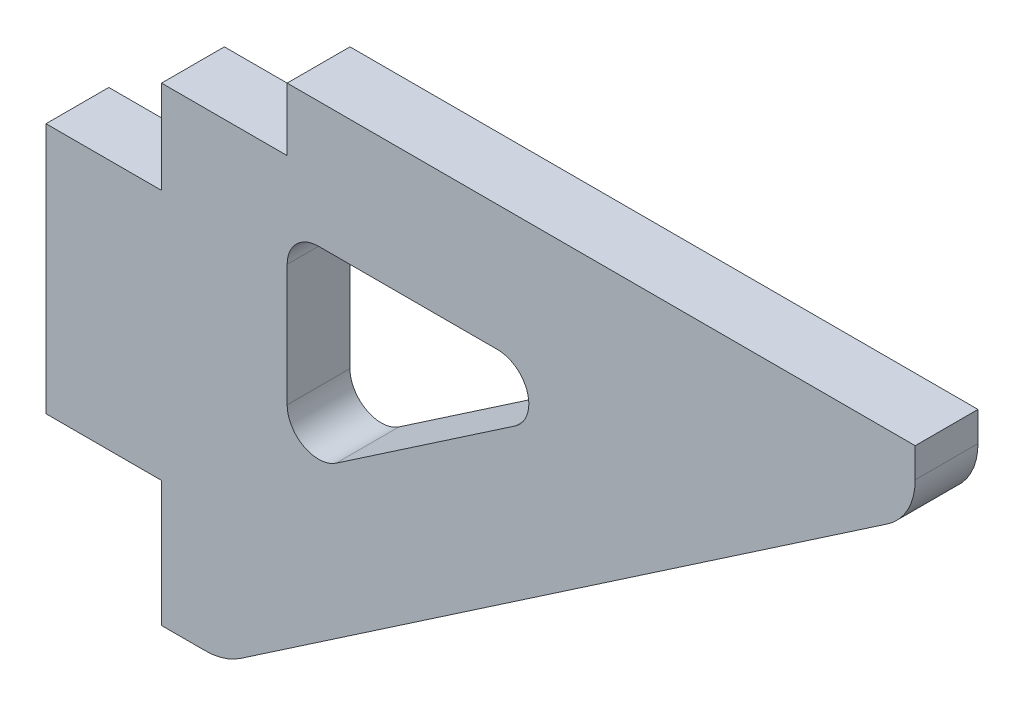
from build123d import *

# Parameters (mm, degrees)
BOSS_EXTRUDE1_DEPTH = 3.175
FILLET1_R           = 1.5875
FILLET2_R           = 3.175


with BuildPart() as part:
    # Sketch1 → Boss-Extrude1 (new body)
    with BuildSketch(Plane.XY):
        Polygon((2.921, 6.35), (2.921, 11.049), (9.271, 11.049), (9.271, 14.224), (41.021, 14.224), (41.021, 11.049), (6.096, -12.7), (2.921, -12.7), (2.921, -6.35), (-2.921, -6.35), (-2.921, 6.35), align=None)
        Polygon((9.271, -2.861962039), (25.05917947, 7.874), (9.271, 7.874), align=None, mode=Mode.SUBTRACT)
    extrude(amount=BOSS_EXTRUDE1_DEPTH)

    # Fillet1
    fillet1_edges = [part.edges().sort_by_distance(p)[0] for p in [
        (25.05917947, 7.874, 1.5875),
        (9.271, 7.874, 1.5875),
        (9.271, -2.861962039, 1.5875),
    ]]
    fillet(fillet1_edges, radius=FILLET1_R)

    # Fillet2
    fillet2_edges = [part.edges().sort_by_distance(p)[0] for p in [
        (6.096, -12.7, 1.5875),
        (41.021, 11.049, 1.5875),
    ]]
    fillet(fillet2_edges, radius=FILLET2_R)


solid = part.part
